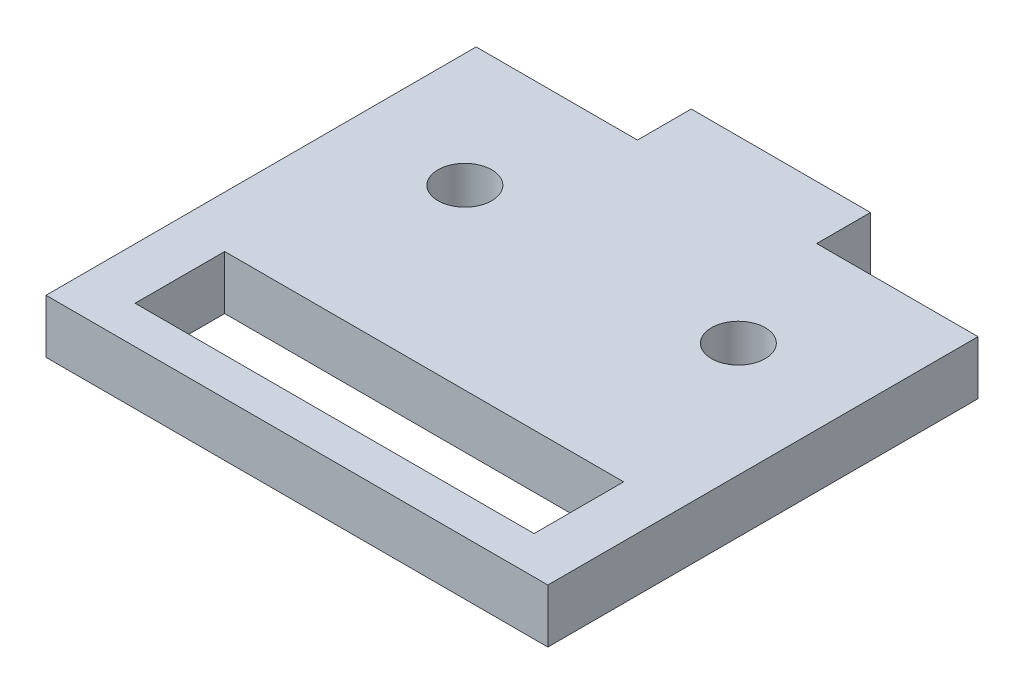
from build123d import *

# Parameters (mm, degrees)
SKETCH1_R           = 1.5
SKETCH1_W           = 22.26
SKETCH1_H           = 5
BOSS_EXTRUDE1_DEPTH = 3


with BuildPart() as part:
    # Sketch1 → Boss-Extrude1 (new body)
    with BuildSketch(Plane(origin=(0, 0, 0), x_dir=(1, 0, 0), z_dir=(0, 1, 0))):
        Polygon((-5, 3), (5, 3), (14, 3), (14, 27), (5, 27), (5, 30), (-5, 30), (-5, 27), (-14, 27), (-14, 3), align=None)
        with Locations((7.63, 20)):
            Circle(SKETCH1_R, mode=Mode.SUBTRACT)
        with Locations((-7.63, 20)):
            Circle(SKETCH1_R, mode=Mode.SUBTRACT)
        with Locations((0, 7.6)):
            Rectangle(SKETCH1_W, SKETCH1_H, mode=Mode.SUBTRACT)
    extrude(amount=BOSS_EXTRUDE1_DEPTH)


solid = part.part
